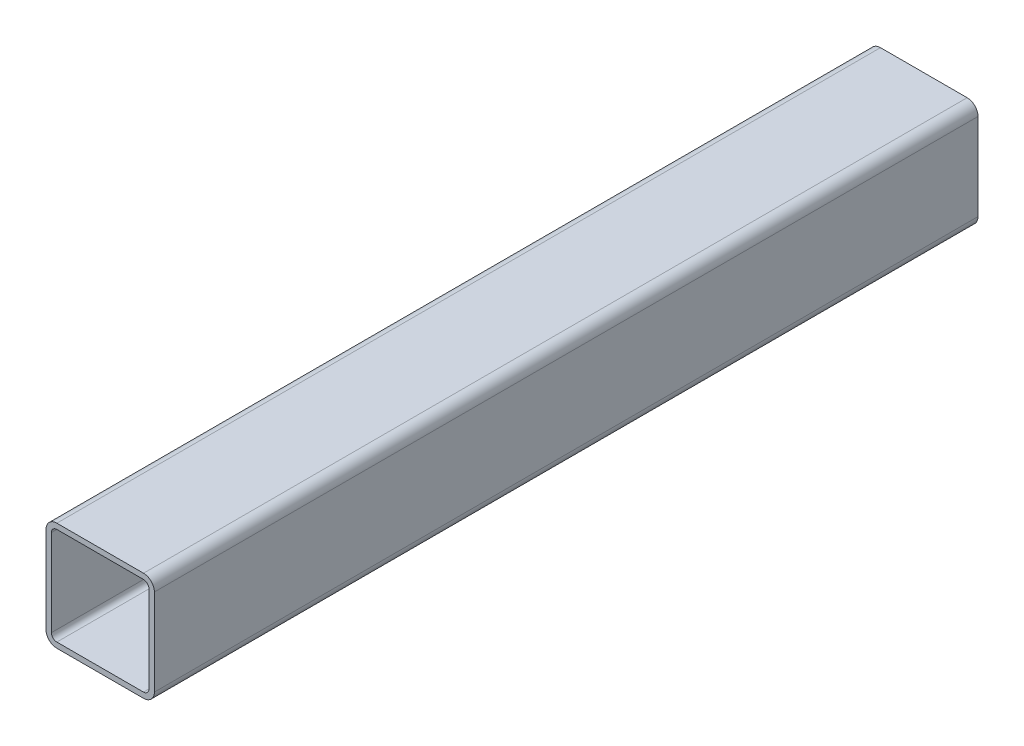
from build123d import *

# Parameters (mm, degrees)
BOSS_EXTRUDE1_DEPTH = 760


with BuildPart() as part:
    # Sketch1 → Boss-Extrude1 (new body)
    with BuildSketch(Plane.XY):
        with BuildLine():
            Line((-40, -50), (40, -50))
            ThreePointArc((40, -50), (47.071067812, -47.071067812), (50, -40))
            Line((50, -40), (50, 40))
            ThreePointArc((50, 40), (47.071067812, 47.071067812), (40, 50))
            Line((40, 50), (-40, 50))
            ThreePointArc((-40, 50), (-47.071067812, 47.071067812), (-50, 40))
            Line((-50, 40), (-50, -40))
            ThreePointArc((-50, -40), (-47.071067812, -47.071067812), (-40, -50))
        make_face()
        with BuildLine():
            Line((-40, 45), (40, 45))
            ThreePointArc((40, 45), (43.535533906, 43.535533906), (45, 40))
            Line((45, 40), (45, -40))
            ThreePointArc((45, -40), (43.535533906, -43.535533906), (40, -45))
            Line((40, -45), (-40, -45))
            ThreePointArc((-40, -45), (-43.535533906, -43.535533906), (-45, -40))
            Line((-45, -40), (-45, 40))
            ThreePointArc((-45, 40), (-43.535533906, 43.535533906), (-40, 45))
        make_face(mode=Mode.SUBTRACT)
    extrude(amount=BOSS_EXTRUDE1_DEPTH)


solid = part.part
